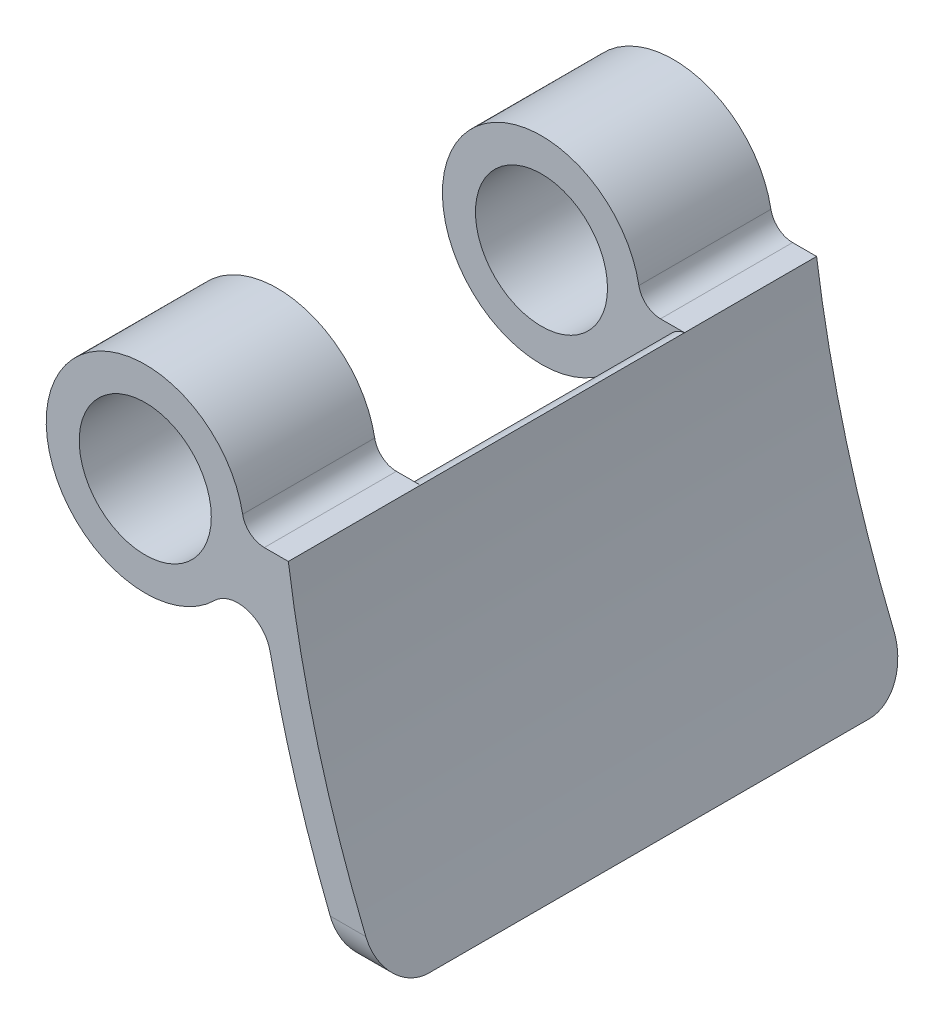
from build123d import *

# Parameters (mm, degrees)
BOSS_EXTRUDE1_DEPTH     = 38.1
FILLET1_R               = 3.175
FILLET2_R               = 6.35
FILLET3_R               = 6.35
FILLET4_R               = 3.175
CUT_EXTRUDE2_DEPTH      = 97.278232488
CUT_EXTRUDE2_DEPTH_BACK = 97.278232488
SKETCH4_R               = 9.525
CUT_EXTRUDE4_DEPTH      = 19.05
FILLET5_R               = 3.175


with BuildPart() as part:
    # Sketch1 → Boss-Extrude1 (new, symmetric)
    with BuildSketch(Plane.XY):
        with BuildLine():
            Line((14.2875, 0), (20.6375, 0))
            ThreePointArc((20.6375, 0), (25.87049136, -24.319115263), (34.567577214, -47.625))
            Line((34.567577214, -47.625), (29.343435198, -47.625))
            ThreePointArc((29.343435198, -47.625), (22.762716722, -30.40866876), (18.016295413, -12.599137554))
            ThreePointArc((18.016295413, -12.599137554), (14.73137517, -9.023483479), (10.017434273, -10.187426899))
            ThreePointArc((10.017434273, -10.187426899), (-13.17681199, 5.523068172), (14.2875, 0))
        make_face()
    extrude(amount=BOSS_EXTRUDE1_DEPTH, both=True)

    # Fillet1
    fillet1_edges = [part.edges().sort_by_distance(p)[0] for p in [
        (14.2875, 0, 0),
    ]]
    fillet(fillet1_edges, radius=FILLET1_R)

    # Fillet2
    fillet2_edges = [part.edges().sort_by_distance(p)[0] for p in [
        (31.955506206, -47.625, 38.1),
    ]]
    fillet(fillet2_edges, radius=FILLET2_R)

    # Fillet3
    fillet3_edges = [part.edges().sort_by_distance(p)[0] for p in [
        (31.955506206, -47.625, -38.1),
    ]]
    fillet(fillet3_edges, radius=FILLET3_R)

    # Fillet4
    # the kernel refuses this fillet: 3.175 mm, written as the material it takes off along each edge
    with BuildSketch(Plane(origin=(29.343435198, -47.625, -36.993879976), x_dir=(-0.3999574931440754, 0.9165336893305706, 0), z_dir=(0, 0, 1))) as fillet4_piece_1:
        with BuildLine():
            CenterArc((2.078655126, -3.174943765), FILLET4_R, 89.658986775, 66.765492029)
            Line((-0.831339338, -1.905078724), (0, 0))
            ThreePointArc((0, 0), (1.048775995, 0.003121064), (2.09755199, 0))
        make_face()
    extrude(amount=73.987759951, mode=Mode.SUBTRACT)

    # Sketch4 → Cut-Extrude2 (cut, two sides: drawn at the far end of the back side and taken through both)
    with BuildSketch(Plane.XY.offset(38.1).offset(-CUT_EXTRUDE2_DEPTH_BACK)):
        Circle(SKETCH4_R)
    extrude(amount=CUT_EXTRUDE2_DEPTH + CUT_EXTRUDE2_DEPTH_BACK, mode=Mode.SUBTRACT)

    # Sketch6 → Cut-Extrude4 (cut, symmetric)
    with BuildSketch(Plane.XY):
        with BuildLine():
            Line((29.343435198, -47.625), (31.081601096, -47.625))
            ThreePointArc((31.081601096, -47.625), (22.620737822, -24.512971667), (17.493272193, -0.440972222))
            Line((17.493272193, -0.440972222), (20.6375, 0))
            Line((20.6375, 0), (17.171437949, 0))
            ThreePointArc((17.171437949, 0), (15.140701126, 0.734358086), (14.049358322, 2.597727273))
            ThreePointArc((14.049358322, 2.597727273), (-13.625992377, 4.297090643), (10.017434273, -10.187426899))
            ThreePointArc((10.017434273, -10.187426899), (14.73137517, -9.023483479), (18.016295413, -12.599137554))
            ThreePointArc((18.016295413, -12.599137554), (22.762716722, -30.40866876), (29.343435198, -47.625))
        make_face()
    extrude(amount=CUT_EXTRUDE4_DEPTH, both=True, mode=Mode.SUBTRACT)

    # Fillet5
    # the kernel refuses this fillet: 3.175 mm, written as the material it takes off along each edge
    with BuildSketch(Plane(origin=(17.493272193, -0.440972222, -19.05), x_dir=(0.14805284588297285, -0.9889794511646602, 0), z_dir=(0, 0, 1))) as fillet5_piece_1:
        with BuildLine():
            CenterArc((3.204535532, 3.174863883), FILLET5_R, 179.469453196, 91.061093608)
            Line((0.029671649, 3.204263291), (0, 0))
            ThreePointArc((0, 0), (1.61696747, -0.007486442), (3.23393494, 0))
        make_face()
    extrude(amount=38.1, mode=Mode.SUBTRACT)


solid = part.part
